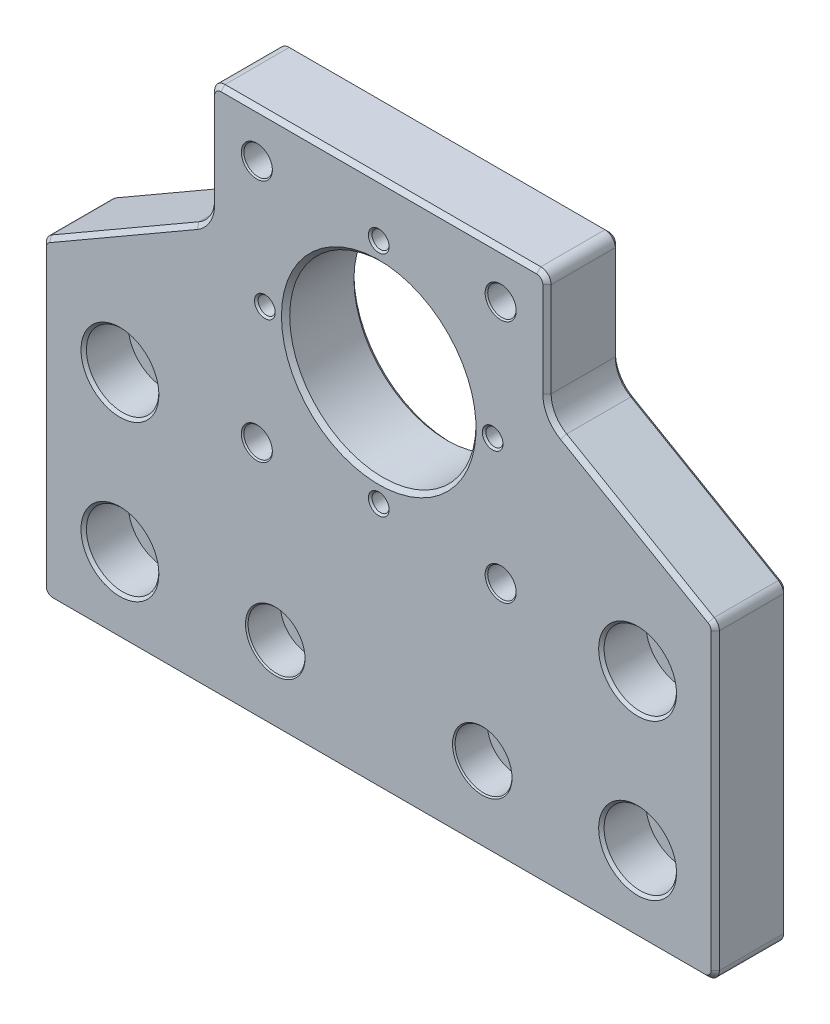
from build123d import *
from build123d.topology import SkipClean

# Parameters (mm, degrees)
BASE_FLANGE1_DEPTH                           = 14
CBORE_FOR_M8_HEX_SOCKET_HEAD_CAP_SCR_2_COUNT = 2
CBORE_FOR_M8_HEX_SOCKET_HEAD_CAP_SCR_2_PITCH = 30
M4_TAPPED_HOLE1_AT_2_COUNT                   = 2
M4_TAPPED_HOLE1_AT_2_PITCH                   = 31.112698372
M4_TAPPED_HOLE1_AT_3_COUNT                   = 2
M4_TAPPED_HOLE1_AT_3_PITCH                   = 44
M4_TAPPED_HOLE1_AT_4_COUNT                   = 2
M4_TAPPED_HOLE1_AT_4_PITCH                   = 31.112698372
CIRPATTERN1_COUNT                            = 4
FILLET2_R                                    = 6
FILLET1_R                                    = 2
CHAMFER1_SIZE                                = 0.8
CHAMFER2_SIZE                                = 0.8


# Sheet-metal steps are written as plain solids
with BuildPart() as part:
    # Sketch1 → Base-Flange1 (new body)
    with BuildSketch(Plane.XY):
        with BuildLine():
            Line((0, 0), (-65, 0))
            Line((-65, 0), (-65, 60))
            Line((-65, 60), (-32.5, 78.763883749))
            Line((-32.5, 78.763883749), (-32.5, 102.5))
            Line((-32.5, 102.5), (0, 102.5))
            Line((0, 102.5), (0, 88))
            ThreePointArc((0, 88), (-18, 70), (0, 52))
            Line((0, 52), (0, 0))
        make_face()
    extrude(amount=-BASE_FLANGE1_DEPTH)

    # Sketch7 → CBORE for M8 Hex Socket Head Cap Screw1 (revolve, cut)
    with BuildSketch(Plane(origin=(-50, 45, 0), x_dir=(0, -1, 0), z_dir=(1, 0, 0))):
        Polygon((0, 0), (0, 14), (4.525, 14), (4.25, 13.725), (4.25, 8.6), (7, 8.6), (7, 0.525), (7.525, 0), align=None)
    cbore_for_m8_hex_socket_head_cap_screw1 = revolve(axis=Axis((-50, 45, 6.35), (0, 0, -1)), mode=Mode.SUBTRACT)

    # CBORE for M8 Hex Socket Head Cap Scr 2: CBORE for M8 Hex Socket Head Cap Screw1 ×2
    with Locations(*[(0, -i * CBORE_FOR_M8_HEX_SOCKET_HEAD_CAP_SCR_2_PITCH, 0) for i in range(1, CBORE_FOR_M8_HEX_SOCKET_HEAD_CAP_SCR_2_COUNT)]):
        add(cbore_for_m8_hex_socket_head_cap_screw1, mode=Mode.SUBTRACT)

    # Sketch18 → CBORE for M6 Hex Socket Head Cap Screw1 (revolve, cut)
    with BuildSketch(Plane(origin=(-20, 15, 0), x_dir=(0, -1, 0), z_dir=(1, 0, 0))):
        Polygon((0, 0), (0, 14), (3.5, 14), (3.25, 13.75), (3.25, 6.5), (5.5, 6.5), (5.5, 0.25), (5.75, 0), align=None)
    revolve(axis=Axis((-20, 15, 6.35), (0, 0, -1)), mode=Mode.SUBTRACT)

    # Mirror1: part across plane


with BuildPart() as part_1:
    with SkipClean():  # the faces are left unmerged after this step: merging them gives an invalid solid
        add(part.part)
        add(part.part.mirror(Plane(origin=(0, 102.5, -14), x_dir=(0, 0, 1), z_dir=(1, 0, 0))))

    # Sketch12 → M4 Tapped Hole1 (revolve, cut)
    with SkipClean():  # the faces are left unmerged after this step: merging them gives an invalid solid
        with BuildSketch(Plane(origin=(-22, 70, 0), x_dir=(0, -1, 0), z_dir=(1, 0, 0))):
            Polygon((0, 0), (0, 14), (2, 14), (1.65, 13.65), (1.65, 0.35), (2, 0), align=None)
        m4_tapped_hole1 = revolve(axis=Axis((-22, 70, 6.35), (0, 0, -1)), mode=Mode.SUBTRACT)

    # M4 Tapped Hole1 at 2: M4 Tapped Hole1 ×2
    with SkipClean():  # the faces are left unmerged after this step: merging them gives an invalid solid
        with Locations(*[Vector(0.7071067811865477, 0.7071067811865474, 0) * (i * M4_TAPPED_HOLE1_AT_2_PITCH) for i in range(1, M4_TAPPED_HOLE1_AT_2_COUNT)]):
            add(m4_tapped_hole1, mode=Mode.SUBTRACT)

    # M4 Tapped Hole1 at 3: M4 Tapped Hole1 ×2
    with SkipClean():  # the faces are left unmerged after this step: merging them gives an invalid solid
        with Locations(*[(i * M4_TAPPED_HOLE1_AT_3_PITCH, 0, 0) for i in range(1, M4_TAPPED_HOLE1_AT_3_COUNT)]):
            add(m4_tapped_hole1, mode=Mode.SUBTRACT)

    # M4 Tapped Hole1 at 4: M4 Tapped Hole1 ×2
    with SkipClean():  # the faces are left unmerged after this step: merging them gives an invalid solid
        with Locations(*[Vector(0.7071067811865475, -0.7071067811865477, 0) * (i * M4_TAPPED_HOLE1_AT_4_PITCH) for i in range(1, M4_TAPPED_HOLE1_AT_4_COUNT)]):
            add(m4_tapped_hole1, mode=Mode.SUBTRACT)

    # Sketch15 → CBORE for M5 Hex Socket Head Cap Screw1 (revolve, cut)
    with SkipClean():  # the faces are left unmerged after this step: merging them gives an invalid solid
        with BuildSketch(Plane(origin=(23.550191347, 93.550191347, -14), x_dir=(0, 1, 0), z_dir=(1, 0, 0))):
            Polygon((0, 0), (0, 14), (3, 14), (2.75, 13.75), (2.75, 5.5), (4.75, 5.5), (4.75, 0.5), (5.25, 0), align=None)
        cbore_for_m5_hex_socket_head_cap_screw1 = revolve(axis=Axis((23.550191347, 93.550191347, -20.35), (0, 0, 1)), mode=Mode.SUBTRACT)

    # CirPattern1: CBORE for M5 Hex Socket Head Cap Screw1 ×4 about axis
    with SkipClean():  # the faces are left unmerged after this step: merging them gives an invalid solid
        cirpattern1_axis = Axis((0, 70, 0), (0, 0, 1))
        for i in range(1, CIRPATTERN1_COUNT):
            add(cbore_for_m5_hex_socket_head_cap_screw1.rotate(cirpattern1_axis, i * 360 / CIRPATTERN1_COUNT), mode=Mode.SUBTRACT)

    # Fillet2
    fillet2_edges = [part_1.edges().sort_by_distance(p)[0] for p in [
        (-32.5, 78.763883749, -7),
        (32.5, 78.763883749, -7),
    ]]
    fillet(fillet2_edges, radius=FILLET2_R)

    # Fillet1
    fillet1_edges = [part_1.edges().sort_by_distance(p)[0] for p in [
        (-65, 60, -7),
        (-32.5, 102.5, -7),
        (-65, 0, -7),
        (65, 60, -7),
        (32.5, 102.5, -7),
        (65, 0, -7),
    ]]
    fillet(fillet1_edges, radius=FILLET1_R)

    # Chamfer1
    chamfer1_edges = [part_1.edges().sort_by_distance(p)[0] for p in [
        (49.75, 68.804591605, 0),
        (49.75, 68.804591605, -14),
        (-49.75, 68.804591605, 0),
        (-49.75, 68.804591605, -14),
        (33.303847577, 79.227985364, 0),
        (33.303847577, 79.227985364, -14),
        (-33.303847577, 79.227985364, 0),
        (-33.303847577, 79.227985364, -14),
        (-31.5, 0, 0),
        (-31.5, 0, -14),
        (32.5, 91.363992682, 0),
        (-15.25, 102.5, 0),
        (-32.5, 91.363992682, 0),
        (-65, 30.422649731, 0),
        (65, 30.422649731, 0),
        (-64.732050808, 59.845299462, 0),
        (-31.914213562, 101.914213562, 0),
        (31.914213562, 101.914213562, 0),
        (64.732050808, 59.845299462, 0),
        (-64.414213562, 0.585786438, 0),
        (64.414213562, 0.585786438, 0),
        (65, 30.422649731, -14),
        (-15.25, 102.5, -14),
        (32.5, 91.363992682, -14),
        (-65, 30.422649731, -14),
        (-32.5, 91.363992682, -14),
        (-64.732050808, 59.845299462, -14),
        (-31.914213562, 101.914213562, -14),
        (31.914213562, 101.914213562, -14),
        (64.732050808, 59.845299462, -14),
        (-64.414213562, 0.585786438, -14),
        (64.414213562, 0.585786438, -14),
    ]]
    chamfer(chamfer1_edges, length=CHAMFER1_SIZE)

    # Chamfer2
    chamfer2_edges = [part_1.edges().sort_by_distance(p)[0] for p in [
        (-18, 70, 0),
        (-18, 70, -14),
    ]]
    chamfer(chamfer2_edges, length=CHAMFER2_SIZE)


solid = part_1.part
